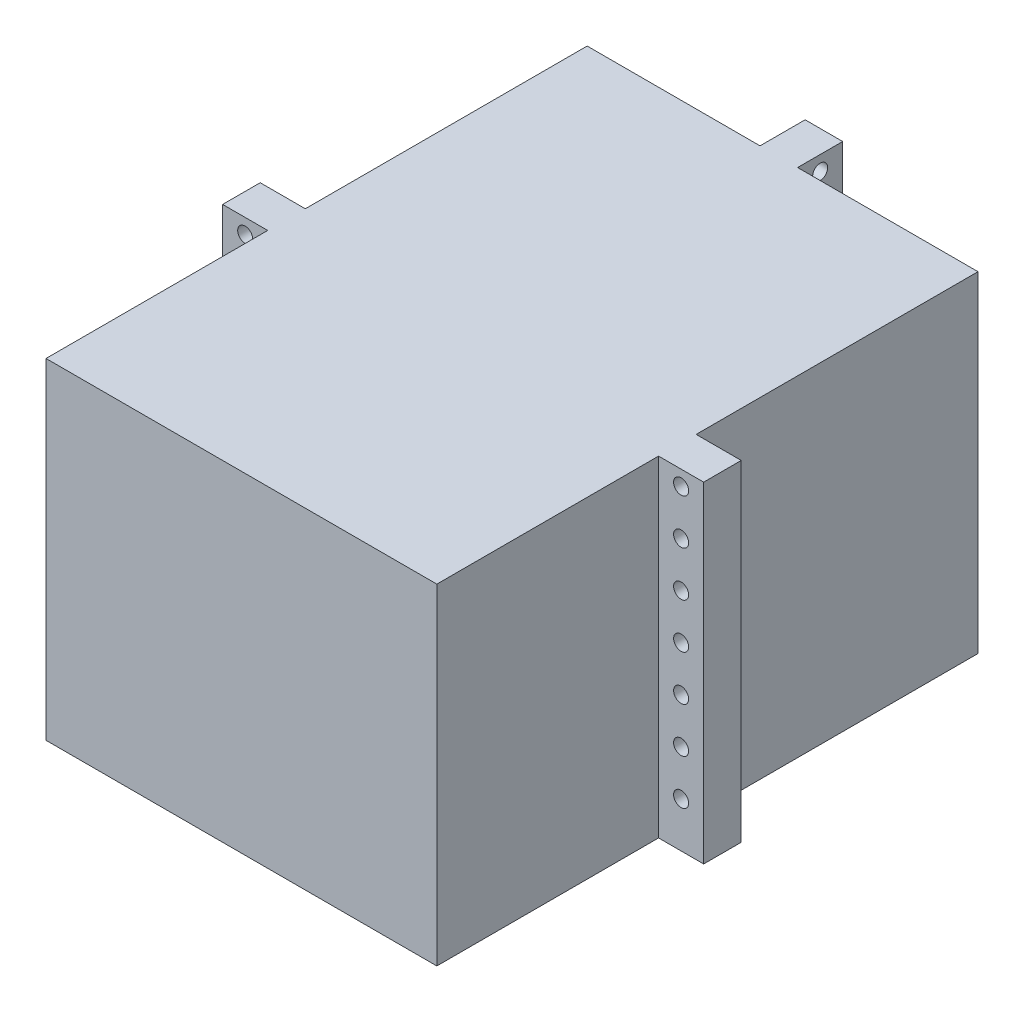
from build123d import *

# Parameters (mm, degrees)
BOSS_EXTRUDE1_DEPTH = 279.4
SKETCH2_R           = 6.35
CUT_EXTRUDE1_DEPTH  = 45.72
SKETCH3_R           = 6.35
CUT_EXTRUDE2_DEPTH  = 45.72


with BuildPart() as part:
    # Sketch1 → Boss-Extrude1 (new body)
    with BuildSketch(Plane(origin=(0, 0, 0), x_dir=(1, 0, 0), z_dir=(0, 1, 0))):
        Polygon((-165.1, -228.6), (-19.05, -228.6), (19.05, -228.6), (165.1, -228.6), (165.1, -41.275), (203.2, -41.275), (203.2, -9.525), (165.1, -9.525), (165.1, 228.6), (12.7, 228.6), (12.7, 266.7), (-19.05, 266.7), (-19.05, 228.6), (-165.1, 228.6), (-165.1, -9.525), (-203.2, -9.525), (-203.2, -41.275), (-165.1, -41.275), align=None)
    extrude(amount=BOSS_EXTRUDE1_DEPTH)

    # Sketch2 → Cut-Extrude1 (cut)
    with BuildSketch(Plane.XY.offset(41.275)):
        with Locations((-184.15, 38.1)):
            Circle(SKETCH2_R)
        with Locations((-184.15, 76.2)):
            Circle(SKETCH2_R)
        with Locations((-184.15, 114.3)):
            Circle(SKETCH2_R)
        with Locations((-184.15, 152.4)):
            Circle(SKETCH2_R)
        with Locations((-184.15, 190.5)):
            Circle(SKETCH2_R)
        with Locations((-184.15, 228.6)):
            Circle(SKETCH2_R)
        with Locations((-184.15, 266.7)):
            Circle(SKETCH2_R)
        with Locations((184.15, 266.7)):
            Circle(SKETCH2_R)
        with Locations((184.15, 228.6)):
            Circle(SKETCH2_R)
        with Locations((184.15, 190.5)):
            Circle(SKETCH2_R)
        with Locations((184.15, 152.4)):
            Circle(SKETCH2_R)
        with Locations((184.15, 114.3)):
            Circle(SKETCH2_R)
        with Locations((184.15, 76.2)):
            Circle(SKETCH2_R)
        with Locations((184.15, 38.1)):
            Circle(SKETCH2_R)
    extrude(amount=-CUT_EXTRUDE1_DEPTH, mode=Mode.SUBTRACT)

    # Sketch3 → Cut-Extrude2 (cut)
    with BuildSketch(Plane.ZY.offset(19.05)):
        with Locations((-247.65, 38.1)):
            Circle(SKETCH3_R)
        with Locations((-247.65, 76.2)):
            Circle(SKETCH3_R)
        with Locations((-247.65, 114.3)):
            Circle(SKETCH3_R)
        with Locations((-247.65, 152.4)):
            Circle(SKETCH3_R)
        with Locations((-247.65, 190.5)):
            Circle(SKETCH3_R)
        with Locations((-247.65, 228.6)):
            Circle(SKETCH3_R)
        with Locations((-247.65, 266.7)):
            Circle(SKETCH3_R)
    extrude(amount=-CUT_EXTRUDE2_DEPTH, mode=Mode.SUBTRACT)


solid = part.part
